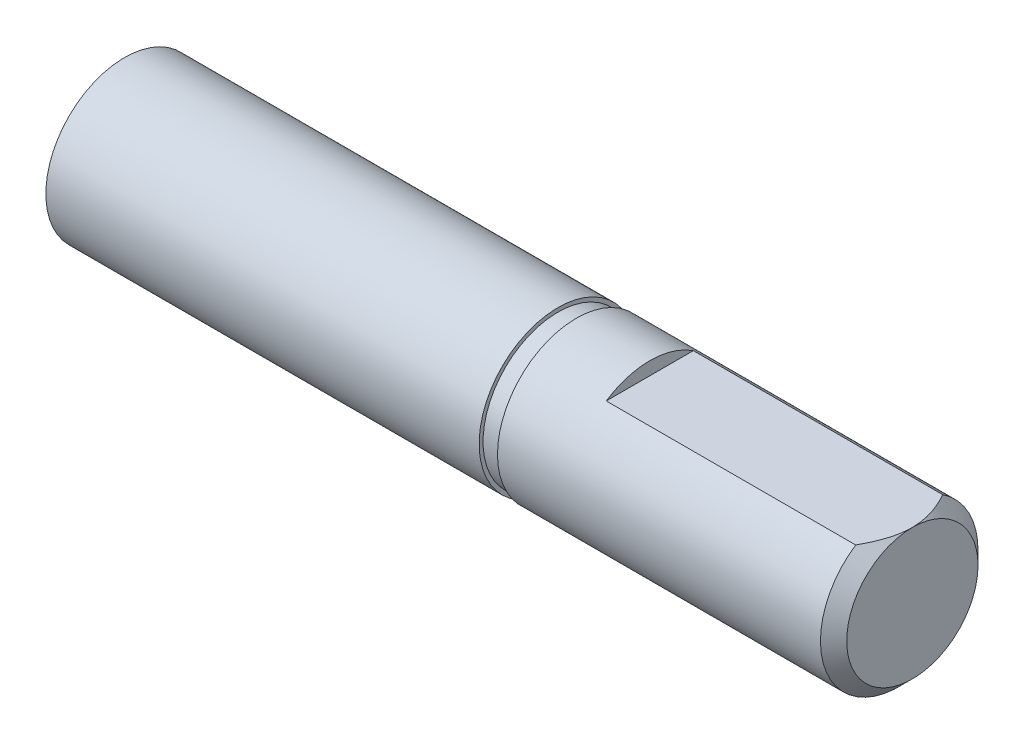
from build123d import *

# Parameters (mm, degrees)
BODYS_R       = 3
BODY_DEPTH    = 15
FLATS_W       = 10
FLATS_H       = 6
FLAT_DEPTH    = 0.5
GROOVES_W     = 0.75
GROOVES_H     = 0.7
CHAMFER1_SIZE = 0.5


with BuildPart() as part:
    # BodyS → Body (new, symmetric)
    with BuildSketch(Plane(origin=(0, 0, 0), x_dir=(0, 0, -1), z_dir=(1, 0, 0))):
        Circle(BODYS_R)
    extrude(amount=BODY_DEPTH, both=True)

    # FlatS → Flat (cut)
    with BuildSketch(Plane(origin=(0, 3, 0), x_dir=(1, 0, 0), z_dir=(0, 1, 0))):
        with Locations((10, 0)):
            Rectangle(FLATS_W, FLATS_H)
    extrude(amount=-FLAT_DEPTH, mode=Mode.SUBTRACT)

    # GrooveS → Groove for ANSI B27.7 - 3AM1-6, Basic External Retaining Ring1 (revolve, cut)
    with BuildSketch(Plane(origin=(-15, 0, 0), x_dir=(0, 0, -1), z_dir=(0, -1, 0))):
        with Locations((3.225, 16.85)):
            Rectangle(GROOVES_W, GROOVES_H)
    revolve(axis=Axis((-62.5, 0, 0), (1, 0, 0)), mode=Mode.SUBTRACT)

    # Chamfer1
    chamfer1_edges = [part.edges().sort_by_distance(p)[0] for p in [
        (15, -2.643382037, 1.418637165),
    ]]
    chamfer(chamfer1_edges, length=CHAMFER1_SIZE - 0.0001)  # a hair under: the kernel refuses the full size


solid = part.part
